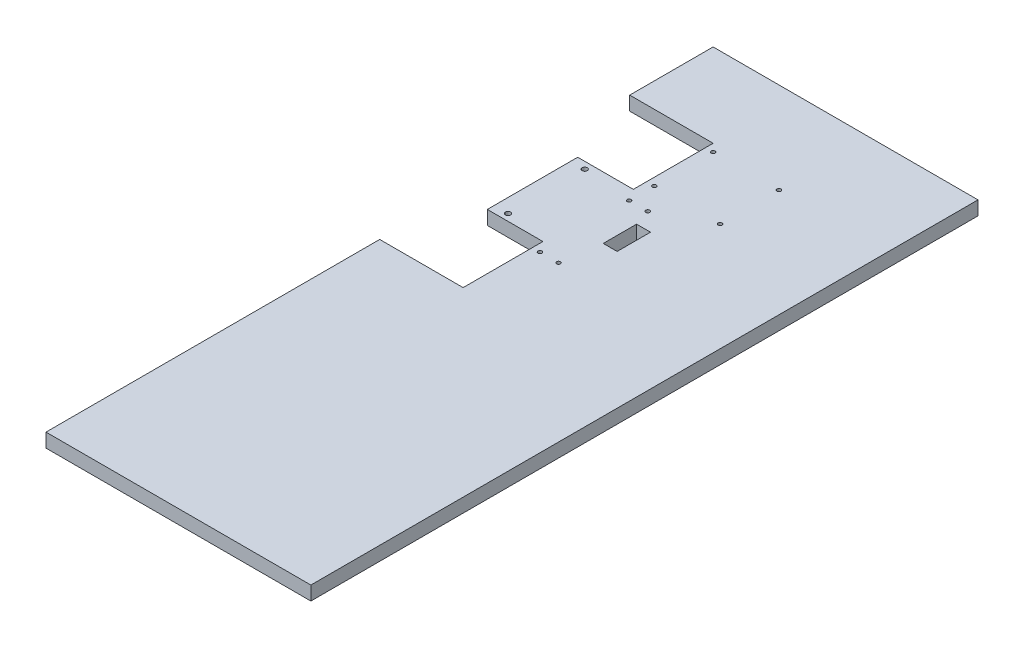
from build123d import *

# Parameters (mm, degrees)
SKETCH1_R           = 0.889
SKETCH1_W           = 6.35
SKETCH1_H           = 15.24
BOSS_EXTRUDE1_DEPTH = 6.35
SKETCH2_R           = 1.1684
CUT_EXTRUDE1_DEPTH  = 6.35


with BuildPart() as part:
    # Sketch1 → Boss-Extrude1 (new body)
    with BuildSketch(Plane(origin=(0, 0, 0), x_dir=(1, 0, 0), z_dir=(0, 1, 0))):
        Polygon((-147.642205972, 18.314662121), (-147.642205972, -22.960337879), (-122.242205972, -22.960337879), (-122.242205972, -59.409337879), (-160.342205972, -59.409337879), (-160.342205972, -211.809337879), (-39.379524296, -211.809337879), (-39.379524296, 92.863662121), (-160.342205972, 92.863662121), (-160.342205972, 54.763662121), (-122.242205972, 54.763662121), (-122.242205972, 18.314662121), align=None)
        with Locations((-118.749705972, -27.815337973)):
            Circle(SKETCH1_R, mode=Mode.SUBTRACT)
        with Locations((-118.749705972, 12.919662091)):
            Circle(SKETCH1_R, mode=Mode.SUBTRACT)
        with Locations((-110.264705924, 12.919662091)):
            Circle(SKETCH1_R, mode=Mode.SUBTRACT)
        with Locations((-110.264705924, -27.815337973)):
            Circle(SKETCH1_R, mode=Mode.SUBTRACT)
        with Locations((-118.749705972, 51.271162121)):
            Circle(SKETCH1_R, mode=Mode.SUBTRACT)
        with Locations((-118.749705972, 24.397962121)):
            Circle(SKETCH1_R, mode=Mode.SUBTRACT)
        with Locations((-88.701505972, 51.271162121)):
            Circle(SKETCH1_R, mode=Mode.SUBTRACT)
        with Locations((-88.701505972, 24.397962121)):
            Circle(SKETCH1_R, mode=Mode.SUBTRACT)
        with Locations((-104.549705924, -2.322837879)):
            Rectangle(SKETCH1_W, SKETCH1_H, mode=Mode.SUBTRACT)
    extrude(amount=BOSS_EXTRUDE1_DEPTH)

    # Sketch2 → Cut-Extrude1 (cut)
    with BuildSketch(Plane(origin=(0, 6.35, 0), x_dir=(1, 0, 0), z_dir=(0, 1, 0))):
        with Locations((-141.292205972, 15.177162121)):
            Circle(SKETCH2_R)
        with Locations((-141.292205972, -19.822837879)):
            Circle(SKETCH2_R)
    extrude(amount=-CUT_EXTRUDE1_DEPTH, mode=Mode.SUBTRACT)


solid = part.part
